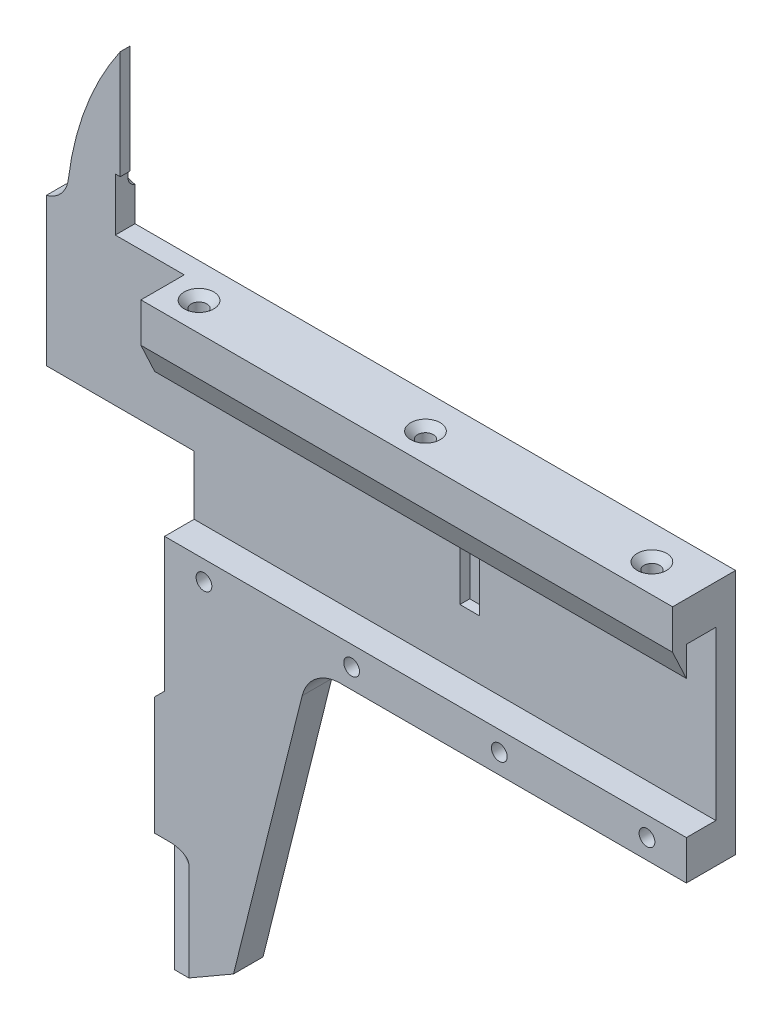
from build123d import *

# Parameters (mm, degrees)
EXTRUDE_1_DEPTH              = 3
EXTRUDE_2_DEPTH              = 2
FILLET_1_R                   = 2
FILLET_2_R                   = 3
CHAMFER_1_SIZE               = 1
EXTRUDE_3_DEPTH              = 54
PATTERN_LINEAR_1_COUNT       = 4
PATTERN_LINEAR_1_PITCH       = 15
HOLE_WIZARD_M2_2_D           = 1.6
HOLE_WIZARD_M2_2_DEPTH       = 4
HOLE_WIZARD_M2_2_CSINK_D     = 3
HOLE_WIZARD_M2_2_CSINK_ANGLE = 90
PATTERN_LINEAR_2_COUNT       = 3
PATTERN_LINEAR_2_PITCH       = 23
CUT_EXTRUDE_1_DEPTH          = 13
FILLET_3_R                   = 1
CUT_EXTRUDE_2_DEPTH          = 13
FILLET_4_R                   = 1
SKETCH_11_W                  = 2.000000000000007
SKETCH_11_H                  = 5
CUT_EXTRUDE_3_DEPTH          = 1


# Some blends are built 0.0001 mm under size
with BuildPart() as part:
    # 草图1 → 凸台-拉伸1 (new body)
    with BuildSketch(Plane.XY):
        with BuildLine():
            Line((-53, -8.000000000000004), (-53, -14.620000000000001))
            Line((-53, -14.620000000000001), (-54, -14.620000000000001))
            Line((-54, -14.620000000000001), (-54, -39.62))
            Line((-54, -39.62), (-45.9979252690319, -35.00000000000001))
            Line((-45.9979252690319, -35.00000000000001), (-39.02479757997029, -7.032312417601319))
            ThreePointArc((-39.02479757997029, -7.032312417601319), (-37.606260576168935, -4.847956985573115), (-35.14361467486631, -4.000000000000005))
            Line((-35.14361467486631, -4.000000000000005), (4.9e-16, -4))
            Line((4.9e-16, -4), (0, 0))
            Line((0, 0), (-53, 0))
            Line((-53, 0), (-53, -8.000000000000004))
        make_face()
    extrude(amount=-EXTRUDE_1_DEPTH)

    # 草图2 → 凸台-拉伸2 (add)
    with BuildSketch(Plane(origin=(0, 0, -3), x_dir=(-1, 0, 0), z_dir=(0, 0, -1))):
        with BuildLine():
            Line((-4.9e-16, -4), (53, -4))
            Line((53, -4), (53, 6.000000000000002))
            Line((53, 6.000000000000002), (68, 6.000000000000002))
            Line((68, 6.000000000000002), (68, 21))
            Line((68, 21), (65.97847727, 21.000000000000004))
            ThreePointArc((65.97847727, 21.000000000000004), (64.40463560690391, 29.57899182713432), (60.50330893032099, 37.379999999999995))
            Line((60.50330893032099, 37.379999999999995), (60.503308930321, 26.379999999999995))
            Line((60.503308930321, 26.379999999999995), (61.003308930321, 26.38))
            Line((61.003308930321, 26.38), (61.003308930321005, 21))
            Line((61.003308930321005, 21), (53, 21))
            Line((53, 21), (0, 21))
            Line((0, 21), (-4.9e-16, -4))
        make_face()
    extrude(amount=EXTRUDE_2_DEPTH)

    # 圆角1
    fillet_1_edges = [part.edges().sort_by_distance(p)[0] for p in [
        (-44.07180733743316, -4, -3),
    ]]
    fillet(fillet_1_edges, radius=FILLET_1_R - 0.0001)  # a hair under: the kernel refuses the full size

    # 圆角2
    # the kernel refuses this fillet: 3 mm, written as the material it adds along each edge
    with BuildSketch(Plane(origin=(-65.97847727, 21.000000000000004, -3), x_dir=(-1, -3.51e-15, 0), z_dir=(0, 0, -1))) as fillet_2_piece_1:
        with BuildLine():
            CenterArc((2.7704921372998013, 2.9050034125503172), FILLET_2_R, 187.01700367904854, 68.52581158586304)
            Line((-0.2070376849391327, 2.5385117241346675), (-0.2665882813839122, 2.531181890366354))
            ThreePointArc((-0.2665882813839122, 2.531181890366354), (-0.13723895323484658, 1.2665056940841235), (-0.05995131454466218, -0.00241658526998755))
            Line((-0.05995131454466218, -0.00241658526998755), (2.1e-16, -0.05999999999999872))
            ThreePointArc((2.1e-16, -0.05999999999999872), (1.0107613649999936, -0.05999999999999517), (2.006543341853998, -0.05810006825100805))
            Line((2.006543341853998, -0.05810006825100805), (2.021522730000001, 0))
        make_face()
    extrude(amount=2)

    # 倒角1
    chamfer_1_edges = [part.edges().sort_by_distance(p)[0] for p in [
        (-53, -14.620000000000001, -1.5),
    ]]
    chamfer(chamfer_1_edges, length=CHAMFER_1_SIZE - 0.0001)  # a hair under: the kernel refuses the full size

    # 草图3 → 凸台-拉伸3 (add)
    with BuildSketch(Plane(origin=(0, 0, 0), x_dir=(0, 0, -1), z_dir=(1, 1.2e-16, 0))):
        Polygon((1.3e-15, 17), (1.73e-15, 14.000000000000002), (-1.3989229744649714, 17), (-1.3989229744649718, 21), (3, 21), (3.0000000000000018, 17), align=None)
    extrude(amount=-EXTRUDE_3_DEPTH)

    # 草图6 → M2 螺纹孔1 (revolve, cut)
    with BuildSketch(Plane(origin=(-4, -1.9999999999999967, 0), x_dir=(0, -1, 0), z_dir=(1, 0, 0))):
        Polygon((0, 0), (-1.1e-15, 4.480688495222049), (0.7999999999999986, 4), (0.7999999999999899, -1.46e-15), align=None)
    hole_wizard_m2_1 = revolve(axis=Axis((-4, -1.9999999999999967, 6.349999999999991), (0, 0, -1)), mode=Mode.SUBTRACT)

    # 阵列(线性)1: M2 螺纹孔1 ×4
    with Locations(*[(-i * PATTERN_LINEAR_1_PITCH, 0, 0) for i in range(1, PATTERN_LINEAR_1_COUNT)]):
        add(hole_wizard_m2_1, mode=Mode.SUBTRACT)

    # M2 螺纹孔2
    with Locations(Plane(origin=(0, 21, 0), x_dir=(1, 0, 0), z_dir=(0, 1, 0))):
        with Locations((-5, 1.5)):
            hole_wizard_m2_2 = CounterSinkHole(HOLE_WIZARD_M2_2_D / 2, HOLE_WIZARD_M2_2_CSINK_D / 2, depth=HOLE_WIZARD_M2_2_DEPTH, counter_sink_angle=HOLE_WIZARD_M2_2_CSINK_ANGLE)

    # 阵列(线性)2: M2 螺纹孔2 ×3
    with Locations(*[(-i * PATTERN_LINEAR_2_PITCH, 0, 0) for i in range(1, PATTERN_LINEAR_2_COUNT)]):
        add(hole_wizard_m2_2, mode=Mode.SUBTRACT)

    # 草图9 → 切除-拉伸1 (cut)
    with BuildSketch(Plane(origin=(3.89e-15, 37.37999999999999, 7.21e-15), x_dir=(1, -1e-16, 0), z_dir=(1e-16, 1, 1.9e-16))):
        Polygon((-60.503308930321, 4.000000000000004), (-62.23535973788988, 5.000000000000007), (-60.503308930321, 5.000000000000007), align=None)
    extrude(amount=-CUT_EXTRUDE_1_DEPTH, mode=Mode.SUBTRACT)

    # 圆角3
    # the kernel refuses this fillet: 1 mm, written as the material it adds along each edge
    with BuildSketch(Plane(origin=(-58.8382454208599, 24.379999999999995, -3.0386751345948144), x_dir=(1.6e-16, 1, 9e-17), z_dir=(-0.8660254037844387, 0, -0.5))) as fillet_3_piece_1_section:
        with BuildLine():
            CenterArc((FILLET_3_R, FILLET_3_R), FILLET_3_R, 179.99999999999997, 90)
            Line((0, FILLET_3_R), (0, 0))
            Line((0, 0), (FILLET_3_R, 0))
        make_face()
    fillet_3_piece_1 = extrude(amount=6.422649730810377, mode=Mode.PRIVATE)
    fillet_3_piece_1 = split(fillet_3_piece_1, bisect_by=Plane(origin=(-61.495158067637725, 24.669870904160934, -5), z_dir=(0, 0, 1)), keep=Keep.TOP, mode=Mode.PRIVATE)
    fillet_3_piece_1 = split(fillet_3_piece_1, bisect_by=Plane(origin=(-61.003308930321, 24.669870904160934, -4.716030766640193), z_dir=(-1, 1.32e-15, 0)), keep=Keep.TOP, mode=Mode.PRIVATE)
    add(fillet_3_piece_1)

    # 草图10 → 切除-拉伸2 (cut)
    with BuildSketch(Plane(origin=(0, -39.62, 0), x_dir=(1, 0, 0), z_dir=(0, 1, 0))):
        Polygon((-54, 2), (-50.53589838486226, 0), (-54, 1.73e-15), align=None)
    extrude(amount=CUT_EXTRUDE_2_DEPTH, mode=Mode.SUBTRACT)

    # 圆角4
    fillet_4_edges = [part.edges().sort_by_distance(p)[0] for p in [
        (-52.26794919243113, -26.619999999999997, -1),
    ]]
    fillet(fillet_4_edges, radius=FILLET_4_R)

    # 草图11 → 切除-拉伸3 (cut)
    with BuildSketch(Plane.XY.offset(-3)):
        with Locations((-25, 8.5)):
            Rectangle(SKETCH_11_W, SKETCH_11_H)
    extrude(amount=-CUT_EXTRUDE_3_DEPTH, mode=Mode.SUBTRACT)


solid = part.part
